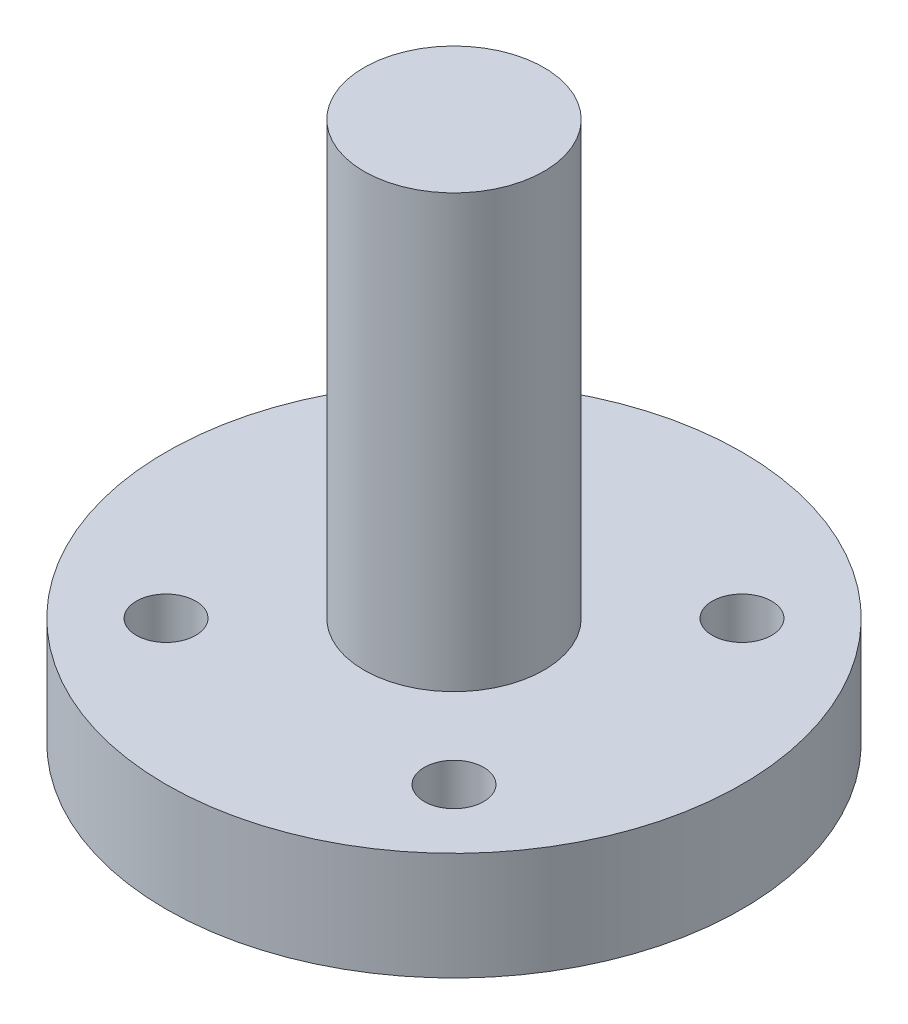
from build123d import *

# Parameters (mm, degrees)
SKETCH1_R                   = 16
BOSS_EXTRUDE1_DEPTH         = 6
TAP_DRILL_FOR_M4X0_7_TAP1_D = 3.3
SKETCH3_R                   = 5
BOSS_EXTRUDE2_DEPTH         = 24


with BuildPart() as part:
    # Sketch1 → Boss-Extrude1 (new body)
    with BuildSketch(Plane(origin=(0, 0, 0), x_dir=(1, 0, 0), z_dir=(0, 1, 0))):
        Circle(SKETCH1_R)
    extrude(amount=BOSS_EXTRUDE1_DEPTH)

    # Tap Drill for M4x0.7 Tap1 (through all)
    with Locations(Plane(origin=(0, 0, 0), x_dir=(-1, 0, 0), z_dir=(0, -1, 0))):
        with Locations((-8, 8), (-8, -8), (8, -8), (8, 8)):
            Hole(TAP_DRILL_FOR_M4X0_7_TAP1_D / 2)

    # Sketch3 → Boss-Extrude2 (add)
    with BuildSketch(Plane(origin=(0, 6, 0), x_dir=(1, 0, 0), z_dir=(0, 1, 0))):
        Circle(SKETCH3_R)
    extrude(amount=BOSS_EXTRUDE2_DEPTH)


solid = part.part
